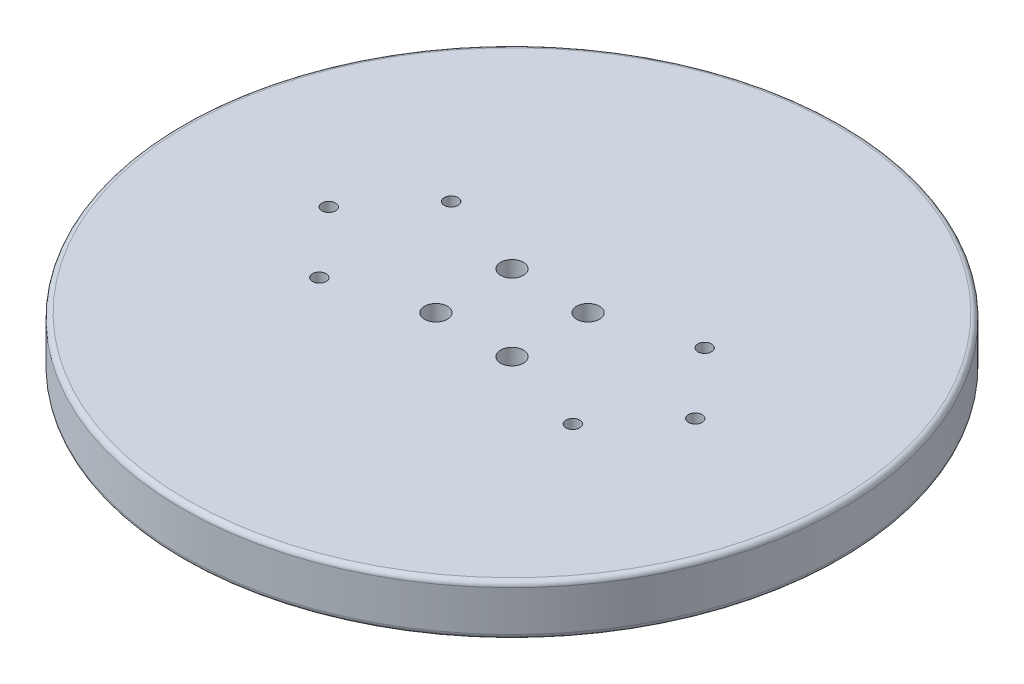
from build123d import *

# Parameters (mm, degrees)
SKETCH1_R             = 65
BOSS_EXTRUDE1_DEPTH   = 10
FILLET1_R             = 1
F_6_32_TAPPED_HOLE1_D = 2.7051
F_8_CLEARANCE_HOLE1_D = 4.4958


with BuildPart() as part:
    # Sketch1 → Boss-Extrude1 (new body)
    with BuildSketch(Plane(origin=(0, 0, 0), x_dir=(1, 0, 0), z_dir=(0, 1, 0))):
        Circle(SKETCH1_R)
    extrude(amount=BOSS_EXTRUDE1_DEPTH)

    # Fillet1
    fillet1_edges = [part.edges().sort_by_distance(p)[0] for p in [
        (-65, 0, 0),
        (-65, 10, 0),
    ]]
    fillet(fillet1_edges, radius=FILLET1_R)

    # #6-32 Tapped Hole1 (through all)
    with Locations(Plane.XZ):
        with Locations((-36.145, 0), (36.145, 0), (-25, -13), (-25, 13), (25, 13), (25, -13)):
            Hole(F_6_32_TAPPED_HOLE1_D / 2)

    # #8 Clearance Hole1 (through all)
    with Locations(Plane(origin=(0, 0, 0), x_dir=(-1, 0, 0), z_dir=(0, -1, 0))):
        with Locations((7.5, -7.5), (-7.5, -7.5), (7.5, 7.5), (-7.5, 7.5)):
            Hole(F_8_CLEARANCE_HOLE1_D / 2)


solid = part.part
